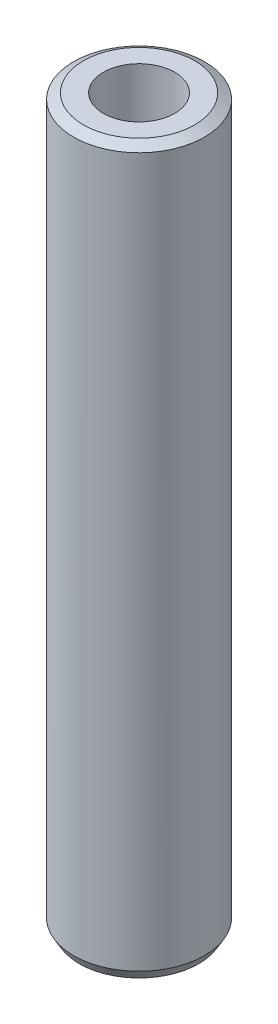
from build123d import *
from OCP.BRepFilletAPI import BRepFilletAPI_MakeChamfer

# Parameters (mm, degrees)
SKETCH1_R           = 42.5
BOSS_EXTRUDE1_DEPTH = 470.475245818
SKETCH2_R           = 23.175845158
CUT_EXTRUDE1_DEPTH  = 475.29891095
CHAMFER1_SIZE       = 3.687056086
CHAMFER1_SIZE2      = 6.386168471


with BuildPart() as part:
    # Sketch1 → Boss-Extrude1 (new body)
    with BuildSketch(Plane(origin=(0, 0, 0), x_dir=(1, 0, 0), z_dir=(0, 1, 0))):
        Circle(SKETCH1_R)
    extrude(amount=BOSS_EXTRUDE1_DEPTH)

    # Sketch2 → Cut-Extrude1 (cut, through all)
    with BuildSketch(Plane(origin=(0, 0, 0), x_dir=(1, 0, 0), z_dir=(0, 1, 0))):
        Circle(SKETCH2_R)
    extrude(amount=CUT_EXTRUDE1_DEPTH, mode=Mode.SUBTRACT)

    # Chamfer1: one chamfer whose edges measure the first distance from different faces: ONE call of the kernel's chamfer builder (chamfer() names one face for all edges)
    chamfer1_edges_1 = [part.edges().sort_by_distance(p)[0] for p in [
        (-42.5, 470.475245818, 0),
    ]]
    chamfer1_side_1 = [part.faces().sort_by_distance(p)[0] for p in [
        (-42.5, 235.237622909, 0),
    ]]
    chamfer1_edges_2 = [part.edges().sort_by_distance(p)[0] for p in [
        (-42.5, 0, 0),
    ]]
    chamfer1_side_2 = [part.faces().sort_by_distance(p)[0] for p in [
        (-41.297918472, 0, 0),
    ]]
    chamfer1 = BRepFilletAPI_MakeChamfer(part.part.solid().wrapped)
    for e in chamfer1_edges_1:
        chamfer1.Add(CHAMFER1_SIZE, CHAMFER1_SIZE2, e.wrapped, chamfer1_side_1[0].wrapped)  # the first distance lies on this face
    for e in chamfer1_edges_2:
        chamfer1.Add(CHAMFER1_SIZE, CHAMFER1_SIZE2, e.wrapped, chamfer1_side_2[0].wrapped)  # the first distance lies on this face
    add(Compound.cast(chamfer1.Shape()), mode=Mode.REPLACE)


solid = part.part
